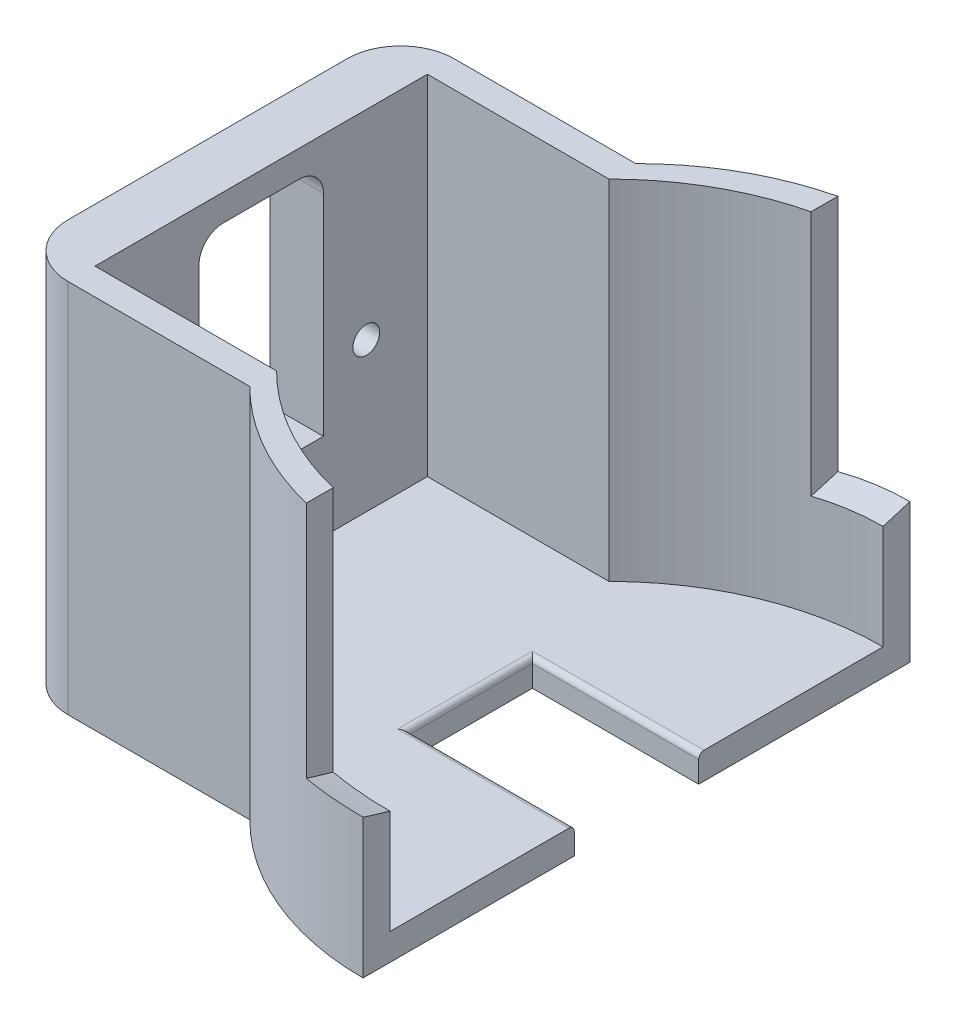
from build123d import *

# Parameters (mm, degrees)
BOSS_EXTRU_5_DEPTH       = 50
ENL_V_MAT_EXTRU_1_DEPTH  = 10
BOSS_EXTRU_6_DEPTH       = 5
ESQUISSE9_W              = 102
ESQUISSE9_H              = 34.999999956
ENL_V_MAT_EXTRU_2_DEPTH  = 110.66312051
ESQUISSE11_R             = 2.5
ENL_V_MAT_EXTRU_9_DEPTH  = 5
ENL_V_MAT_EXTRU_12_DEPTH = 12
CONG_1_R                 = 10
ESQUISSE12_W             = 31
ESQUISSE12_H             = 23.2
ENL_V_MAT_EXTRU_13_DEPTH = 10
CONG_2_R                 = 1


with BuildPart() as part:
    # Esquisse1 → Boss.-Extru.5 (new, symmetric)
    with BuildSketch(Plane(origin=(0, 0, 0), x_dir=(1, 0, 0), z_dir=(0, 1, 0))):
        with BuildLine():
            Line((0, 46), (0, 51))
            ThreePointArc((0, 51), (-19.557607216, 47.100955404), (-36.124783736, 36))
            Line((-36.124783736, 36), (-80, 36))
            Line((-80, 36), (-80, -36))
            Line((-80, -36), (-36.124783736, -36))
            ThreePointArc((-36.124783736, -36), (-19.557607216, -47.100955404), (0, -51))
            Line((0, -51), (0, -46))
            ThreePointArc((0, -46), (-19.557607216, -42.100955404), (-36.124783736, -31))
            Line((-36.124783736, -31), (-70, -31))
            Line((-70, -31), (-70, 31))
            Line((-70, 31), (-36.124783736, 31))
            ThreePointArc((-36.124783736, 31), (-19.557607216, 42.100955404), (0, 46))
        make_face()
    extrude(amount=BOSS_EXTRU_5_DEPTH, both=True)

    # Esquisse5 → Enlèv. mat.-Extru.1 (cut)
    with BuildSketch(Plane(origin=(-70, 0, 0), x_dir=(0, 0, -1), z_dir=(1, 0, 0))):
        with BuildLine():
            Line((-11.59999996, 5.499999956), (-11.59999996, -33.8))
            Line((-11.59999996, -33.8), (11.60000004, -33.8))
            Line((11.60000004, -33.8), (11.60000004, 5.500000044))
            ThreePointArc((11.60000004, 5.500000044), (10.281980555, 8.68198056), (7.10000004, 10.000000044))
            Line((7.10000004, 10.000000044), (-7.099999871, 10.000000044))
            ThreePointArc((-7.099999871, 10.000000044), (-10.281980449, 8.681980534), (-11.59999996, 5.499999956))
        make_face()
    extrude(amount=-ENL_V_MAT_EXTRU_1_DEPTH, mode=Mode.SUBTRACT)

    # Esquisse8 → Boss.-Extru.6 (add)
    with BuildSketch(Plane(origin=(0, -50, 0), x_dir=(1, 0, 0), z_dir=(0, 1, 0))):
        with BuildLine():
            Line((0, -51), (0, 51))
            ThreePointArc((0, 51), (-19.557607216, 47.100955404), (-36.124783736, 36))
            Line((-36.124783736, 36), (-80, 36))
            Line((-80, 36), (-80, -36))
            Line((-80, -36), (-36.124783736, -36))
            ThreePointArc((-36.124783736, -36), (-19.557607216, -47.100955404), (0, -51))
        make_face()
    extrude(amount=-BOSS_EXTRU_6_DEPTH)

    # Esquisse9 → Enlèv. mat.-Extru.2 (cut, through all)
    with BuildSketch(Plane(origin=(0, 0, 0), x_dir=(0, 0, -1), z_dir=(1, 0, 0))):
        with Locations((0, 32.500000022)):
            Rectangle(ESQUISSE9_W, ESQUISSE9_H)
    extrude(amount=-ENL_V_MAT_EXTRU_2_DEPTH, mode=Mode.SUBTRACT)

    # Esquisse11 → Enlèv. mat.-Extru.9 (cut)
    with BuildSketch(Plane(origin=(-70, 0, 0), x_dir=(0, 0, -1), z_dir=(1, 0, 0))):
        with Locations((-19.59999996, -22.213953621)):
            Circle(ESQUISSE11_R)
        with Locations((19.59999996, -22.213953621)):
            Circle(ESQUISSE11_R)
    extrude(amount=-ENL_V_MAT_EXTRU_9_DEPTH, mode=Mode.SUBTRACT)

    # Esquisse10 → Enlèv. mat.-Extru.12 (cut)
    with BuildSketch(Plane(origin=(0, 0, 0), x_dir=(0, 0, -1), z_dir=(1, 0, 0))):
        with BuildLine():
            Line((136.28713183, 33.486696785), (85.263165158, 65.69401727))
            ThreePointArc((85.263165158, 65.69401727), (0, 23.205492896), (-85.263165158, 65.69401727))
            Line((-85.263165158, 65.69401727), (-136.28713183, 33.486696785))
            ThreePointArc((-136.28713183, 33.486696785), (0, -37), (136.28713183, 33.486696785))
        make_face()
    extrude(amount=-ENL_V_MAT_EXTRU_12_DEPTH, mode=Mode.SUBTRACT)

    # Congé1
    cong_1_edges = [part.edges().sort_by_distance(p)[0] for p in [
        (-80, -19.999999978, 36),
        (-80, -19.999999978, -36),
    ]]
    fillet(cong_1_edges, radius=CONG_1_R)

    # Esquisse12 → Enlèv. mat.-Extru.13 (cut)
    with BuildSketch(Plane(origin=(0, -55, 0), x_dir=(-1, 0, 0), z_dir=(0, -1, 0))):
        with Locations((15.5, 0)):
            Rectangle(ESQUISSE12_W, ESQUISSE12_H)
    extrude(amount=-ENL_V_MAT_EXTRU_13_DEPTH, mode=Mode.SUBTRACT)

    # Congé2
    cong_2_edges = [part.edges().sort_by_distance(p)[0] for p in [
        (-15.5, -50, -11.6),
        (-31, -50, 0),
        (-15.5, -50, 11.6),
    ]]
    fillet(cong_2_edges, radius=CONG_2_R)


solid = part.part
